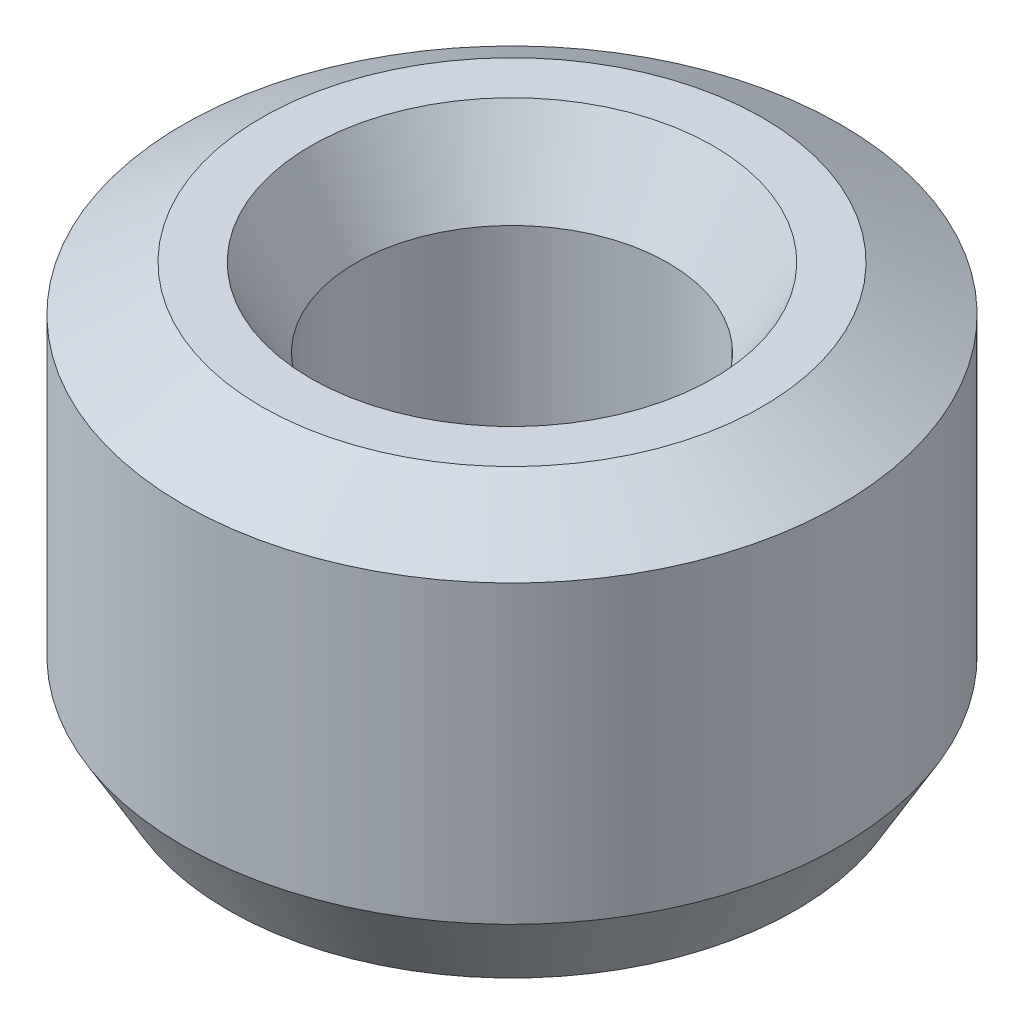
from build123d import *
from OCP.BRepFilletAPI import BRepFilletAPI_MakeChamfer

# Parameters (mm, degrees)
SKETCH1_R           = 10
BOSS_EXTRUDE1_DEPTH = 12.755046052
SKETCH2_R           = 4.743728927
CUT_EXTRUDE1_DEPTH  = 20.044453255
CHAMFER1_SIZE       = 1.378755129
CHAMFER1_SIZE2      = 2.388073934


with BuildPart() as part:
    # Sketch1 → Boss-Extrude1 (new body)
    with BuildSketch(Plane(origin=(0, 0, 0), x_dir=(1, 0, 0), z_dir=(0, 1, 0))):
        Circle(SKETCH1_R)
    extrude(amount=BOSS_EXTRUDE1_DEPTH)

    # Sketch2 → Cut-Extrude1 (cut, through all)
    with BuildSketch(Plane(origin=(0, 0, 0), x_dir=(1, 0, 0), z_dir=(0, 1, 0))):
        Circle(SKETCH2_R)
    extrude(amount=CUT_EXTRUDE1_DEPTH, mode=Mode.SUBTRACT)

    # Chamfer1: one chamfer whose edges measure the first distance from different faces: ONE call of the kernel's chamfer builder (chamfer() names one face for all edges)
    chamfer1_edges_1 = [part.edges().sort_by_distance(p)[0] for p in [
        (-4.743728927, 12.755046052, 0),
    ]]
    chamfer1_side_1 = [part.faces().sort_by_distance(p)[0] for p in [
        (-9.717157288, 12.755046052, 0),
    ]]
    chamfer1_edges_2 = [part.edges().sort_by_distance(p)[0] for p in [
        (-4.743728927, 0, 0),
    ]]
    chamfer1_side_2 = [part.faces().sort_by_distance(p)[0] for p in [
        (-4.743728927, 6.377523026, 0),
    ]]
    chamfer1_edges_3 = [part.edges().sort_by_distance(p)[0] for p in [
        (-10, 0, 0),
    ]]
    chamfer1_side_3 = [part.faces().sort_by_distance(p)[0] for p in [
        (-9.717157288, 0, 0),
    ]]
    chamfer1_edges_4 = [part.edges().sort_by_distance(p)[0] for p in [
        (-10, 12.755046052, 0),
    ]]
    chamfer1_side_4 = [part.faces().sort_by_distance(p)[0] for p in [
        (-10, 6.377523026, 0),
    ]]
    chamfer1 = BRepFilletAPI_MakeChamfer(part.part.solid().wrapped)
    for e in chamfer1_edges_1:
        chamfer1.Add(CHAMFER1_SIZE, CHAMFER1_SIZE2, e.wrapped, chamfer1_side_1[0].wrapped)  # the first distance lies on this face
    for e in chamfer1_edges_2:
        chamfer1.Add(CHAMFER1_SIZE, CHAMFER1_SIZE2, e.wrapped, chamfer1_side_2[0].wrapped)  # the first distance lies on this face
    for e in chamfer1_edges_3:
        chamfer1.Add(CHAMFER1_SIZE, CHAMFER1_SIZE2, e.wrapped, chamfer1_side_3[0].wrapped)  # the first distance lies on this face
    for e in chamfer1_edges_4:
        chamfer1.Add(CHAMFER1_SIZE, CHAMFER1_SIZE2, e.wrapped, chamfer1_side_4[0].wrapped)  # the first distance lies on this face
    add(Compound.cast(chamfer1.Shape()), mode=Mode.REPLACE)


solid = part.part
